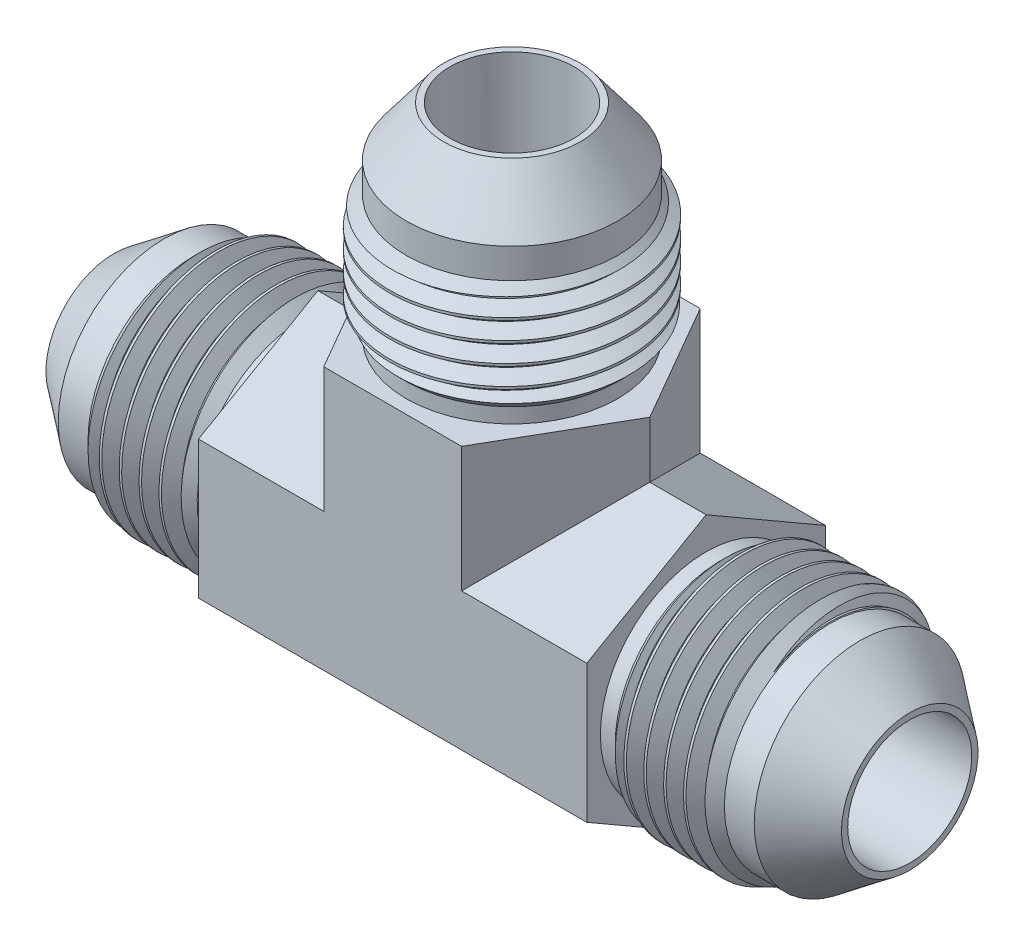
from build123d import *

# Parameters (mm, degrees)
SKETCH3_W               = 16.256
SKETCH3_H               = 9.525
CUT_SWEEP2_PITCH        = 1.5875
CIRPATTERN1_COUNT       = 3
CIRPATTERN1_ANGLE       = 180
BOSS_EXTRUDE1_DEPTH     = 30.988
BOSS_EXTRUDE2_DEPTH     = 9.994738686
SKETCH13_R              = 4.953
CUT_EXTRUDE1_DEPTH      = 72.63126501
CUT_EXTRUDE2_REACH      = 56.095
CUT_EXTRUDE2_END_RADIUS = 4.953
SKETCH34_R              = 4.953


# Read off the part's stored shape, not the designer's step: Boss-Extrude2
with BuildPart() as part:
    # Sketch3 → Revolve1 (revolve)
    with BuildSketch(Plane.XY, mode=Mode.PRIVATE) as revolve1_sk:
        with Locations((-23.622, 4.7625)):
            Rectangle(SKETCH3_W, SKETCH3_H)
    revolve(revolve1_sk.sketch.rotate(Axis((-31.75, 0, 0), (1, 0, 0)), 90), axis=Axis((-31.75, 0, 0), (1, 0, 0)))

    # Cut-Sweep2: the profile of Sketch30 profile screwed along a right-hand helix of 16 turns, 8 arcs to a turn; built about Z, then put on its axis
    cut_sweep2_z = Axis((0, 0, 0), (0, 0, 1))
    cut_sweep2_corners = [(9.5253, 0, -1.389235705), (9.5253, 0, 0.000173205), (8.493888504, 0, -0.5953125), (8.493888504, 0, -0.79375)]
    with BuildLine(mode=Mode.PRIVATE) as cut_sweep2_profile:
        Line(cut_sweep2_corners[0], cut_sweep2_corners[1])
        Line(cut_sweep2_corners[1], cut_sweep2_corners[2])
        Line(cut_sweep2_corners[2], cut_sweep2_corners[3])
        Line(cut_sweep2_corners[3], cut_sweep2_corners[0])
    cut_sweep2_cap = Face(cut_sweep2_profile.wire())
    cut_sweep2_turn_angles = [0, 22.5, 45, 67.5, 90, 112.5, 135, 157.5, 180, 202.5, 225, 247.5, 270, 292.5, 315, 337.5, 360]
    cut_sweep2_turn_weights = [1, 0.9238795325112867, 1, 0.9238795325112867, 1, 0.9238795325112867, 1, 0.9238795325112867, 1, 0.9238795325112867, 1, 0.9238795325112867, 1, 0.9238795325112867, 1, 0.9238795325112867, 1]
    cut_sweep2_turn_rails = [Edge.make_bspline([Vector(p[0], p[1], 0).rotate(cut_sweep2_z, cut_sweep2_turn_angles[k]) / cut_sweep2_turn_weights[k] + Vector(0, 0, p[2] + CUT_SWEEP2_PITCH * cut_sweep2_turn_angles[k] / 360) for k in range(17)], [0, 0, 0, 1, 1, 2, 2, 3, 3, 4, 4, 5, 5, 6, 6, 7, 7, 8, 8, 8], 2, cut_sweep2_turn_weights) for p in cut_sweep2_corners]
    cut_sweep2_turn_sides = [Face.make_surface_from_curves(cut_sweep2_turn_rails[p[0]], cut_sweep2_turn_rails[p[1]]) for p in [(0, 1), (1, 2), (2, 3), (3, 0)]]
    cut_sweep2 = Plane(origin=(-31.75, 0, 0), x_dir=(0, 1, 0), z_dir=(1, 0, 0)) * Solid(Shell([*[p.moved(Location((0, 0, CUT_SWEEP2_PITCH * i))) for i in range(16) for p in cut_sweep2_turn_sides], cut_sweep2_cap, cut_sweep2_cap.rotate(cut_sweep2_z, 5760).moved(Location((0, 0, CUT_SWEEP2_PITCH * 5760 / 360)))]))
    add(cut_sweep2, mode=Mode.SUBTRACT)

    # Sketch31 → Cut-Revolve4 (revolve, cut)
    with BuildSketch(Plane.XY):
        Polygon((-31.75, 9.525), (-31.75, 5.4483), (-27.775781424, 8.443088504), (-25.394531424, 8.443088504), (-24.312619928, 9.525), align=None)
        Polygon((-17.766536496, 9.525), (-16.684625, 8.443088504), (-15.494, 8.443088504), (-15.494, 9.525), align=None)
    revolve(axis=Axis((0, 0, 0), (-1, 0, 0)), mode=Mode.SUBTRACT)


with BuildPart() as cirpattern1_1:
    # CirPattern1: pattern copy
    add(part.part.rotate(Axis((0, 0, -8.443088504), (0, 0, -1)), 1 * CIRPATTERN1_ANGLE / (CIRPATTERN1_COUNT - 1)))


with BuildPart() as cirpattern1_2:
    # CirPattern1: pattern copy
    add(part.part.rotate(Axis((0, 0, -8.443088504), (0, 0, -1)), 2 * CIRPATTERN1_ANGLE / (CIRPATTERN1_COUNT - 1)))


with BuildPart() as part_1:
    add(part.part)

    add(cirpattern1_2.part)  # Boss-Extrude1 merges CirPattern1_2
    # Sketch8 → Boss-Extrude1 (add)
    with BuildSketch(Plane(origin=(-15.494, 0, 0), x_dir=(0, 0, -1), z_dir=(1, 0, 0))):
        Polygon((0, -10.998522628), (9.525, -5.499261314), (9.525, 5.499261314), (0, 10.998522628), (-9.525, 5.499261314), (-9.525, -5.499261314), align=None)
    extrude(amount=BOSS_EXTRUDE1_DEPTH)

    add(cirpattern1_1.part)  # Boss-Extrude2 merges CirPattern1_1
    # Boss-Extrude2 outline → Boss-Extrude2 (add)
    with BuildSketch(Plane.XZ.offset(-15.494)):
        Polygon((5.499261313, 9.525), (-5.499261315, 9.525), (-10.998522629, 1e-09), (-5.499261315, -9.525000001), (5.499261313, -9.525), (10.998522627, 1e-09), align=None)
    extrude(amount=BOSS_EXTRUDE2_DEPTH)

    # Sketch13 → Cut-Extrude1 (cut, through all)
    with BuildSketch(Plane.ZY.offset(31.75)):
        Circle(SKETCH13_R)
    extrude(amount=-CUT_EXTRUDE1_DEPTH, mode=Mode.SUBTRACT)

    # Cut-Extrude2: up to this cylinder (the profile starts outside it)
    cut_extrude2_end = Plane(origin=(0, 0, 0), z_dir=(-1, 0, 0)) * Cylinder(CUT_EXTRUDE2_END_RADIUS, 123.096, mode=Mode.PRIVATE)
    # Sketch34 → Cut-Extrude2 (cut, up to the surface)
    with BuildSketch(Plane(origin=(0, 31.75, 0), x_dir=(1, 0, 0), z_dir=(0, 1, 0)), mode=Mode.PRIVATE) as cut_extrude2_sk1:
        with Locations(Location((0, 0, 0), (0, 0, 180))):
            Circle(SKETCH34_R)
    cut_extrude2_tool1 = extrude(cut_extrude2_sk1.sketch, amount=-CUT_EXTRUDE2_REACH, mode=Mode.PRIVATE) - cut_extrude2_end
    add(cut_extrude2_tool1.solids().sort_by_distance((0, 31.75, 0))[0], mode=Mode.SUBTRACT)


solid = part_1.part
